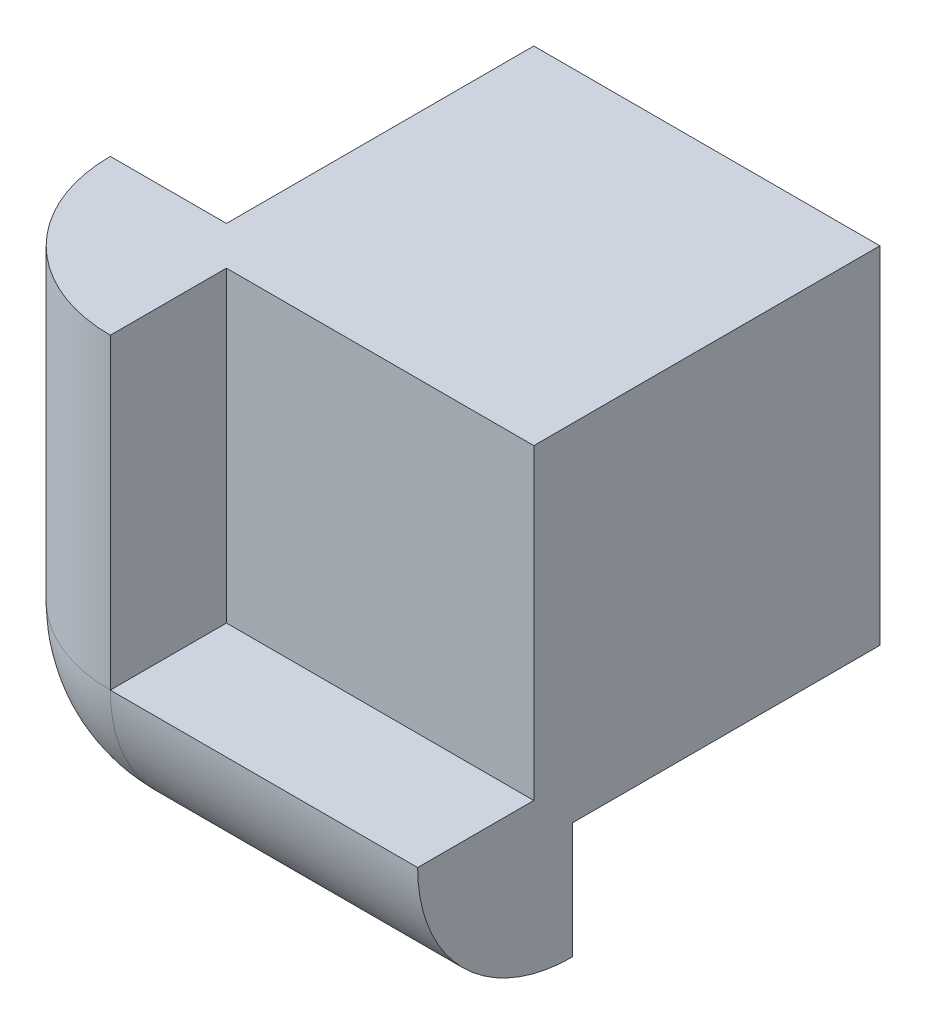
from build123d import *

# Parameters (mm, degrees)
BOSS_EXTRUDE1_DEPTH = 8.937498
SKETCH2_W           = 4
SKETCH2_H           = 4
BOSS_EXTRUDE4_DEPTH = 8.937498
SKETCH3_W           = 4
SKETCH3_H           = 4
BOSS_EXTRUDE5_DEPTH = 11.9375
FILLET1_R           = 4
SKETCH4_R           = 0.9
CUT_EXTRUDE1_DEPTH  = 6


with BuildPart() as part:
    # Sketch1 → Boss-Extrude1 (new body)
    with BuildSketch(Plane(origin=(0, 0, 0), x_dir=(1, 0, 0), z_dir=(0, 1, 0))):
        Polygon((8.937498, 8.937498), (0, 8.937498), (0, 1), (-3, 1), (-3, -3), (1, -3), (1, 0), (8.937498, 0), align=None)
    extrude(amount=BOSS_EXTRUDE1_DEPTH)

    # Sketch2 → Boss-Extrude4 (add)
    with BuildSketch(Plane.XY):
        with Locations((-1, -1)):
            Rectangle(SKETCH2_W, SKETCH2_H)
    extrude(amount=-BOSS_EXTRUDE4_DEPTH)

    # Sketch3 → Boss-Extrude5 (add)
    with BuildSketch(Plane.ZY.offset(3)):
        with Locations((1, -1)):
            Rectangle(SKETCH3_W, SKETCH3_H)
    extrude(amount=-BOSS_EXTRUDE5_DEPTH)

    # Fillet1
    fillet1_edges = [part.edges().sort_by_distance(p)[0] for p in [
        (-3, -3, -2.968749),
        (2.96875, -3, 3),
        (-3, 2.968749, 3),
    ]]
    fillet(fillet1_edges, radius=FILLET1_R - 0.0001)  # a hair under: the kernel refuses the full size

    # Sketch4 → Cut-Extrude1 (cut)
    with BuildSketch(Plane.XZ):
        with Locations(Location((4.968749, -4.968749, 0), (0, 0, 270))):
            Circle(SKETCH4_R)
    extrude(amount=-CUT_EXTRUDE1_DEPTH, mode=Mode.SUBTRACT)


solid = part.part
